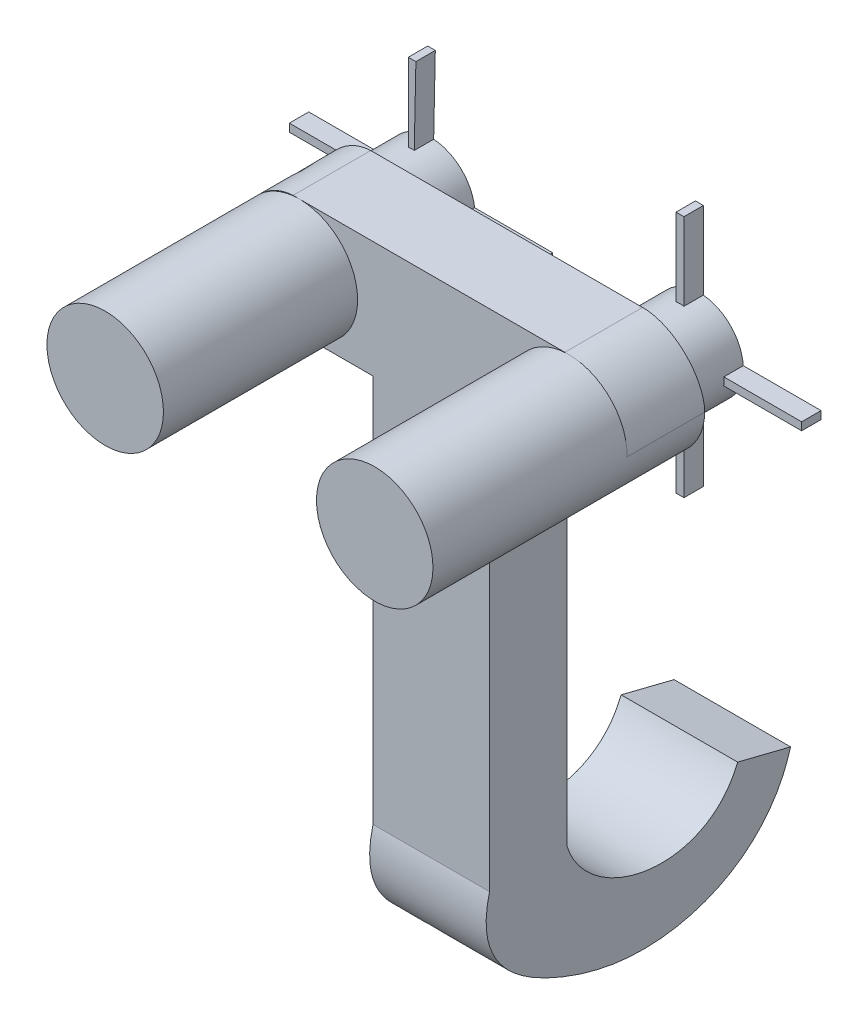
from build123d import *

# Parameters (mm, degrees)
SKETCH_3_R        = 1.5
EXTRUDE_1_DEPTH   = 5
EXTRUDE_1_2_DEPTH = 5
EXTRUDE_2_DEPTH   = 2
SKETCH_5_W        = 2.853543821
SKETCH_5_H        = 2
EXTRUDE_3_DEPTH   = 10
EXTRUDE_4_DEPTH   = 3
SKETCH_10_R       = 1.140914645
EXTRUDE_5_DEPTH   = 1.5
EXTRUDE_7_DEPTH   = 0.5
EXTRUDE_8_DEPTH   = 0.5


with BuildPart() as part:
    # 草圖3 → 填料-伸長1 (new body)
    with BuildSketch(Plane.XY):
        with Locations((-33.675131422, 21.688784622)):
            Circle(SKETCH_3_R)
    extrude(amount=EXTRUDE_1_DEPTH)



with BuildPart() as body_2:
    # 草圖3 → Extrude 1 2 (new body)
    with BuildSketch(Plane.XY):
        with Locations((-26.734723807, 21.688784622)):
            Circle(SKETCH_3_R)
    extrude(amount=EXTRUDE_1_2_DEPTH)


with BuildPart() as part_1:
    add(part.part)

    add(body_2.part)  # 填料-伸長2 merges body 2
    # 草圖4 → 填料-伸長2 (add)
    with BuildSketch(Plane(origin=(0, 0, 0), x_dir=(-1, 0, 0), z_dir=(0, 0, -1))):
        with BuildLine():
            Line((26.734723807, 20.188784622), (33.773684802, 20.188784622))
            add(Edge.make_bspline(
                [(33.773684802, 20.188784622), (34.535913563, 20.165938291), (35.800929175, 21.670744954), (34.562530417, 23.154977058), (33.837200757, 23.188784622)],
                knots=[0.49596594, 0.49596594, 0.49596594, 0.49596594, 1.003722463, 1.49596594, 1.49596594, 1.49596594, 1.49596594], degree=3))
            Line((33.837200757, 23.188784622), (26.838155817, 23.188784622))
            add(Edge.make_bspline(
                [(26.838155817, 23.188784622), (26.073269192, 23.203676172), (25.257278865, 22.443518648), (25.235052535, 21.65738277)],
                knots=[0.985612962, 0.985612962, 0.985612962, 0.985612962, 1.505437172, 1.505437172, 1.505437172, 1.505437172], degree=3))
            ThreePointArc((25.235052535, 21.65738277), (25.685224588, 20.617079724), (26.734723807, 20.188784622))
        make_face()
    extrude(amount=EXTRUDE_2_DEPTH)

    # 草圖5 → 填料-伸長3 (add)
    with BuildSketch(Plane(origin=(0, 10.188784622, 0), x_dir=(-1, 0, 0), z_dir=(0, -1, 0))):
        with Locations((30.204927615, 1)):
            Rectangle(SKETCH_5_W, SKETCH_5_H)
    extrude(amount=-EXTRUDE_3_DEPTH)

    # 草圖8 → 填料-伸長4 (add)
    with BuildSketch(Plane(origin=(-28.778155704, 0, 0), x_dir=(0, 0, -1), z_dir=(1, 0, 0))):
        with BuildLine():
            Line((7.753330976, 9.542330649), (6.389830359, 9.884094062))
            add(Edge.make_bspline(
                [(2, 10.188784622), (2.558381759, 8.463399482), (5.5807632, 7.860963804), (6.389830359, 9.884094062)],
                knots=[0, 0, 0, 0, 1, 1, 1, 1], degree=3))
            Line((2, 10.188784622), (2, 20.188784622))
            Line((2, 20.188784622), (0, 20.188784622))
            Line((0, 20.188784622), (0, 10.188784622))
            add(Edge.make_bspline(
                [(0, 10.188784622), (-0.398570445, 8.648488045), (1.245527503, 7.423981535), (4.706611011, 6.530691208), (7.218164442, 7.643363971), (7.753330976, 9.542330649)],
                knots=[0, 0, 0, 0, 0.333348157, 0.526950405, 1, 1, 1, 1], degree=3))
        make_face()
    extrude(amount=-EXTRUDE_4_DEPTH)

    # 草圖10 → 填料-伸長5 (add)
    with BuildSketch(Plane(origin=(0, 0, -2), x_dir=(-1, 0, 0), z_dir=(0, 0, -1))):
        with Locations((26.882024428, 21.612290926)):
            Circle(SKETCH_10_R)
        with Locations((33.793332146, 21.612290926)):
            Circle(SKETCH_10_R)
    extrude(amount=EXTRUDE_5_DEPTH)

    # 草圖11 → 填料-伸長7 (add)
    with BuildSketch(Plane(origin=(0, 0, -3.5), x_dir=(-1, 0, 0), z_dir=(0, 0, -1))):
        Polygon((25.743585867, 21.687416623), (23.740328845, 21.687416623), (23.740328845, 21.48582297), (25.748140799, 21.48582297), align=None)
        Polygon((30.023720011, 21.687416623), (30.023720011, 21.48582297), (28.015908057, 21.48582297), (28.020462989, 21.687416623), align=None)
        Polygon((26.975262544, 20.475192477), (26.975262544, 18.478571509), (26.771288276, 18.478571509), (26.771288276, 20.476762972), align=None)
        Polygon((26.975262544, 24.746010342), (26.771288276, 24.746010342), (26.771288276, 22.747818879), (26.975262544, 22.749389374), align=None)
    extrude(amount=-EXTRUDE_7_DEPTH)

    # 草圖13 → 填料-伸長8 (add)
    with BuildSketch(Plane(origin=(0, 0, -3.5), x_dir=(-1, 0, 0), z_dir=(0, 0, -1))):
        Polygon((33.870263598, 20.473972965), (33.870263598, 18.471384146), (33.674184292, 18.471384146), (33.716400694, 20.473972965), align=None)
        Polygon((33.870263598, 22.750608887), (33.716400694, 22.750608887), (33.674184292, 24.753197705), (33.870263598, 24.753197705), align=None)
        Polygon((32.654217182, 21.548233701), (30.653079653, 21.548233701), (30.653079653, 21.751970744), (32.661000138, 21.751970744), align=None)
        Polygon((36.933584638, 21.548233701), (36.933584638, 21.751970744), (34.925664154, 21.751970744), (34.932447109, 21.548233701), align=None)
    extrude(amount=-EXTRUDE_8_DEPTH)


solid = part_1.part
